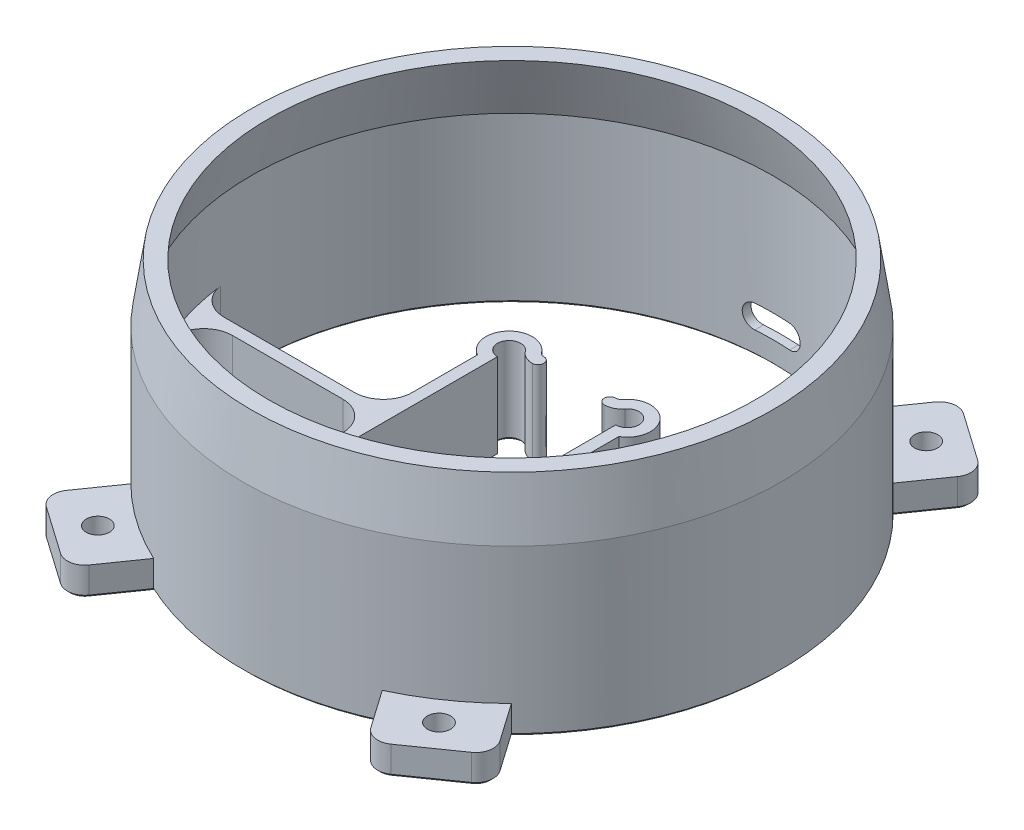
from build123d import *

# Parameters (mm, degrees)
SKETCH1_R               = 46.5
SKETCH1_R_2             = 45
BOSS_EXTRUDE1_DEPTH     = 38.5
CHAMFER1_SIZE           = 10
CHAMFER1_SIZE_2         = 1.5
CUT_EXTRUDE1_REACH      = 78.202
CUT_EXTRUDE1_END_RADIUS = 46.5
BOSS_EXTRUDE3_DEPTH     = 15
FILLET2_R               = 5
BOSS_EXTRUDE4_DEPTH     = 15
FILLET4_R               = 5
SKETCH3_R               = 2
BOSS_EXTRUDE2_DEPTH     = 5
FILLET1_R               = 3
FILLET1_OF_MIRROR3_R    = 3
MIRROR4_OUTLINE_R       = 2
MIRROR4_DEPTH           = 5
CHAMFER2_SIZE           = 0.5


# Read off the part's stored shape, not the designer's step: Mirror4
with BuildPart() as part:
    # Sketch1 → Boss-Extrude1 (new body)
    with BuildSketch(Plane(origin=(0, 0, 0), x_dir=(1, 0, 0), z_dir=(0, 1, 0))):
        with Locations(Location((0, 0, 0), (0, 0, 270))):
            Circle(SKETCH1_R)
        with Locations(Location((0, 0, 0), (0, 0, 270))):
            Circle(SKETCH1_R_2, mode=Mode.SUBTRACT)
    extrude(amount=BOSS_EXTRUDE1_DEPTH)

    # Chamfer1
    # the kernel refuses this chamfer: 10, 1.5 mm, written as the material it takes off along each edge
    with BuildSketch(Plane(origin=(0, 38.5, 0), x_dir=(0, 0, 1), z_dir=(-1, 0, 0))) as chamfer1_piece_1:
        Polygon((46.5, -CHAMFER1_SIZE), (46.5 - CHAMFER1_SIZE_2, 0), (46.5, 0), align=None)
    revolve(axis=Axis((0, 38.5, 0), (0, 1, 0)), mode=Mode.SUBTRACT)

    # Sketch2 → Revolve1 (revolve)
    with BuildSketch(Plane(origin=(0, 0, 0), x_dir=(0, 0, -1), z_dir=(1, 0, 0)), mode=Mode.PRIVATE) as revolve1_sk:
        Polygon((-45, 38.5), (-42, 38.5), (-45, 28.5), align=None)
    revolve(revolve1_sk.sketch.rotate(Axis((0, 2.458093048, 0), (0, 1, 0)), 180), axis=Axis((0, 2.458093048, 0), (0, 1, 0)))

    # Cut-Extrude1: up to this cylinder (the profile starts inside it)
    cut_extrude1_end = Plane(origin=(0, 6, 0), z_dir=(0, -1, 0)) * Cylinder(CUT_EXTRUDE1_END_RADIUS, 250.404, mode=Mode.PRIVATE)
    # Sketch5 → Cut-Extrude1 (cut, up to the surface)
    with BuildSketch(Plane.XY, mode=Mode.PRIVATE) as cut_extrude1_sk1:
        with BuildLine():
            Line((3, 4), (-3, 4))
            ThreePointArc((-3, 4), (-5, 6), (-3, 8))
            Line((-3, 8), (3, 8))
            ThreePointArc((3, 8), (5, 6), (3, 4))
        make_face()
    cut_extrude1_tool1 = extrude(cut_extrude1_sk1.sketch, amount=-CUT_EXTRUDE1_REACH, mode=Mode.PRIVATE) & cut_extrude1_end
    add(cut_extrude1_tool1.solids().sort_by_distance((0, 6, 0))[0], mode=Mode.SUBTRACT)

    # Sketch7 → Boss-Extrude3 (add)
    with BuildSketch(Plane.XZ):
        with BuildLine():
            Line((-10.2, 1), (-10.2, 21))
            ThreePointArc((-10.2, 21), (-11.2, 22), (-12.2, 21))
            Line((-12.2, 21), (-12.2, 11.997110965))
            Line((-12.2, 11.997110965), (-43.371296136, 11.997110965))
            ThreePointArc((-43.371296136, 11.997110965), (-43.634848459, 11), (-43.875480309, 9.997110965))
            Line((-43.875480309, 9.997110965), (-12.2, 9.997110965))
            Line((-12.2, 9.997110965), (-12.2, 1))
            Line((-12.2, 1), (-10.2, 1))
        make_face()
        with BuildLine():
            Line((1, 45), (-1, 45))
            Line((-1, 45), (-1, 33.7))
            Line((-1, 33.7), (-7.5, 33.7))
            ThreePointArc((-7.5, 33.7), (-8.5, 32.7), (-7.5, 31.7))
            Line((-7.5, 31.7), (7.5, 31.7))
            ThreePointArc((7.5, 31.7), (8.5, 32.7), (7.5, 33.7))
            Line((7.5, 33.7), (1, 33.7))
            Line((1, 33.7), (1, 45))
        make_face()
        with BuildLine():
            Line((43.371296136, 11.997110965), (12.2, 11.997110965))
            Line((12.2, 11.997110965), (12.2, 21))
            ThreePointArc((12.2, 21), (11.2, 22), (10.2, 21))
            Line((10.2, 21), (10.2, 1))
            Line((10.2, 1), (12.2, 1))
            Line((12.2, 1), (12.2, 9.997110965))
            Line((12.2, 9.997110965), (43.875480309, 9.997110965))
            ThreePointArc((43.875480309, 9.997110965), (43.634848459, 11), (43.371296136, 11.997110965))
        make_face()
    extrude(amount=-BOSS_EXTRUDE3_DEPTH)

    # Fillet2
    fillet2_edges = [part.edges().sort_by_distance(p)[0] for p in [
        (-12.2, 7.5, 11.997110965),
        (-12.2, 7.5, 9.997110965),
        (12.2, 7.5, 11.997110965),
        (12.2, 7.5, 9.997110965),
        (1, 7.5, 33.7),
        (-1, 7.5, 33.7),
    ]]
    fillet(fillet2_edges, radius=FILLET2_R)

    # Sketch9 → Boss-Extrude4 (add)
    with BuildSketch(Plane.XZ):
        with BuildLine():
            ThreePointArc((-12.2, -6.235898385), (-13.192811711, -12.353879813), (-7, -12.1))
            ThreePointArc((-7, -12.1), (-6.647213595, -11.805572809), (-6.2, -11.7))
            Line((-6.2, -11.7), (-6.2, -9.7))
            ThreePointArc((-6.2, -9.7), (-7.541640786, -10.016718427), (-8.6, -10.9))
            ThreePointArc((-8.6, -10.9), (-11.988854382, -10.594427191), (-10.2, -7.7))
            Line((-10.2, -7.7), (-10.2, 1))
            Line((-10.2, 1), (-12.2, 1))
            Line((-12.2, 1), (-12.2, -6.235898385))
        make_face()
        with BuildLine():
            ThreePointArc((-6.2, -9.7), (-5.2, -10.7), (-6.2, -11.7))
            Line((-6.2, -11.7), (-6.2, -9.7))
        make_face()
    boss_extrude4 = extrude(amount=-BOSS_EXTRUDE4_DEPTH)

    # Mirror2: Boss-Extrude4 across plane
    add(boss_extrude4.mirror(Plane(origin=(0, 0, 0), x_dir=(0, 0, 1), z_dir=(1, 0, 0))))

    # Fillet4
    fillet4_edges = [part.edges().sort_by_distance(p)[0] for p in [
        (-43.875480309, 7.5, 9.997110965),
        (-43.371296136, 7.5, 11.997110965),
        (43.371296136, 7.5, 11.997110965),
        (43.875480309, 7.5, 9.997110965),
        (1, 7.5, 44.988887517),
        (-1, 7.5, 44.988887517),
    ]]
    fillet(fillet4_edges, radius=FILLET4_R)

    # Sketch3 → Boss-Extrude2 (add)
    with BuildSketch(Plane.XZ):
        Polygon((39.13617733, 41.94467928), (26.029744621, 51.121902262), (19.720403821, 42.111229775), (32.82683653, 32.934006793), align=None)
        with Locations(Location((29.428290576, 42.027954527, 0), (0, 0, 270))):
            Circle(SKETCH3_R, mode=Mode.SUBTRACT)
    boss_extrude2 = extrude(amount=-BOSS_EXTRUDE2_DEPTH)

    # Fillet1
    fillet1_edges = [part.edges().sort_by_distance(p)[0] for p in [
        (26.029744621, 2.5, 51.121902262),
        (39.13617733, 2.5, 41.94467928),
    ]]
    fillet(fillet1_edges, radius=FILLET1_R)

    # Mirror3: Boss-Extrude2 across plane
    add(boss_extrude2.mirror(Plane.XY))

    # Fillet1 of Mirror3
    fillet1_of_mirror3_edges = [part.edges().sort_by_distance(p)[0] for p in [
        (26.029744621, 2.5, -51.121902262),
        (39.13617733, 2.5, -41.94467928),
    ]]
    fillet(fillet1_of_mirror3_edges, radius=FILLET1_OF_MIRROR3_R)

    # Mirror4 outline → Mirror4 (add)
    # profile 1 of 2: a face of its own
    with BuildSketch(Plane(origin=(0, 0, 0), x_dir=(1, 0, 0), z_dir=(0, 1, 0))):
        with BuildLine():
            ThreePointArc((-36.678721197, 43.665408589), (-37.912415147, 41.728896989), (-37.415448021, 39.487223147))
            Line((-37.415448021, 39.487223147), (-32.82683653, 32.934006793))
            ThreePointArc((-32.82683653, 32.934006793), (-26.67130429, 38.09057006), (-19.720403821, 42.111229775))
            Line((-19.720403821, 42.111229775), (-24.309015312, 48.664446129))
            ThreePointArc((-24.309015312, 48.664446129), (-26.245526912, 49.898140079), (-28.487200754, 49.401172953))
            Line((-28.487200754, 49.401172953), (-36.678721197, 43.665408589))
        make_face()
        with Locations((-29.428290576, 42.027954527)):
            Circle(MIRROR4_OUTLINE_R, mode=Mode.SUBTRACT)
    # profile 2 of 2: a face of its own
    with BuildSketch(Plane(origin=(0, 0, 0), x_dir=(1, 0, 0), z_dir=(0, 1, 0))):
        with BuildLine():
            ThreePointArc((-19.720403821, -42.111229775), (-26.67130429, -38.09057006), (-32.82683653, -32.934006793))
            Line((-32.82683653, -32.934006793), (-37.415448021, -39.487223147))
            ThreePointArc((-37.415448021, -39.487223147), (-37.912415147, -41.728896989), (-36.678721197, -43.665408589))
            Line((-36.678721197, -43.665408589), (-28.487200754, -49.401172953))
            ThreePointArc((-28.487200754, -49.401172953), (-26.245526912, -49.898140079), (-24.309015312, -48.664446129))
            Line((-24.309015312, -48.664446129), (-19.720403821, -42.111229775))
        make_face()
        with Locations((-29.428290576, -42.027954527)):
            Circle(MIRROR4_OUTLINE_R, mode=Mode.SUBTRACT)
    extrude(amount=MIRROR4_DEPTH)

    # Chamfer2
    chamfer2_edges = [part.edges().sort_by_distance(p)[0] for p in [
        (-28.443316772, 0, 9.997110965),
        (-12.2, 0, 18.998555483),
        (-26.70454514, 0, 11.997110965),
        (6.75, 0, 33.7),
        (28.443316772, 0, 9.997110965),
        (26.70454514, 0, 11.997110965),
        (12.2, 0, 18.998555483),
        (-13.664466094, 0, 8.532644871),
        (-13.664466094, 0, 13.461577059),
        (-2.464466094, 0, 35.164466094),
        (2.464466094, 0, 35.164466094),
        (13.664466094, 0, 8.532644871),
        (13.664466094, 0, 13.461577059),
        (-11.988854382, 0, -10.594427191),
        (-7.541640786, 0, -10.016718427),
        (-5.2, 0, -10.7),
        (-13.192811711, 0, -12.353879813),
        (-6.647213595, 0, -11.805572809),
        (11.988854382, 0, -10.594427191),
        (7.541640786, 0, -10.016718427),
        (5.2, 0, -10.7),
        (6.647213595, 0, -11.805572809),
        (13.192811711, 0, -12.353879813),
        (-26.918576263, 0, 36.06092417),
        (0, 0, -45),
        (26.918576263, 0, 36.06092417),
        (1, 0, 39.123719933),
        (-1, 0, 39.123719933),
        (-40.429469074, 0, 14.315991269),
        (-42.993959173, 0, 8.746990587),
        (40.429469074, 0, 14.315991269),
        (42.993959173, 0, 8.746990587),
        (2.740398797, 0, 43.338877589),
        (-2.740398797, 0, 43.338877589),
        (46.5, 0, 0),
        (35.121142275, 0, 36.21061497),
        (29.428290576, 0, 44.027954527),
        (32.582960975, 0, 46.533290771),
        (22.014709567, 0, 45.387837952),
        (26.245526912, 0, 49.898140079),
        (37.912415147, 0, 41.728896989),
        (0, 0, -46.5),
        (29.428290576, 0, -44.027954527),
        (35.121142275, 0, -36.21061497),
        (-11.2, 0, 22),
        (-10.2, 0, 6.65),
        (32.582960975, 0, -46.533290771),
        (-12.2, 0, -0.61939371),
        (22.014709567, 0, -45.387837952),
        (26.245526912, 0, -49.898140079),
        (37.912415147, 0, -41.728896989),
        (10.101430975, 0, 45.389548271),
        (-31.428290576, 0, 42.027954527),
        (-35.121142276, 0, 36.21061497),
        (-32.582960976, 0, 46.533290771),
        (-22.014709567, 0, 45.387837952),
        (-26.245526912, 0, 49.898140079),
        (-37.912415147, 0, 41.728896989),
        (-46.5, 0, 0),
        (-35.121142276, 0, -36.21061497),
        (-31.428290576, 0, -42.027954527),
        (-32.582960976, 0, -46.533290771),
        (-22.014709567, 0, -45.387837952),
        (-26.245526912, 0, -49.898140079),
        (-37.912415147, 0, -41.728896989),
        (11.2, 0, 22),
        (10.2, 0, 6.65),
        (12.2, 0, -0.61939371),
        (-8.5, 0, 32.7),
        (0, 0, 31.7),
        (8.5, 0, 32.7),
        (-6.75, 0, 33.7),
    ]]
    chamfer(chamfer2_edges, length=CHAMFER2_SIZE)


solid = part.part
